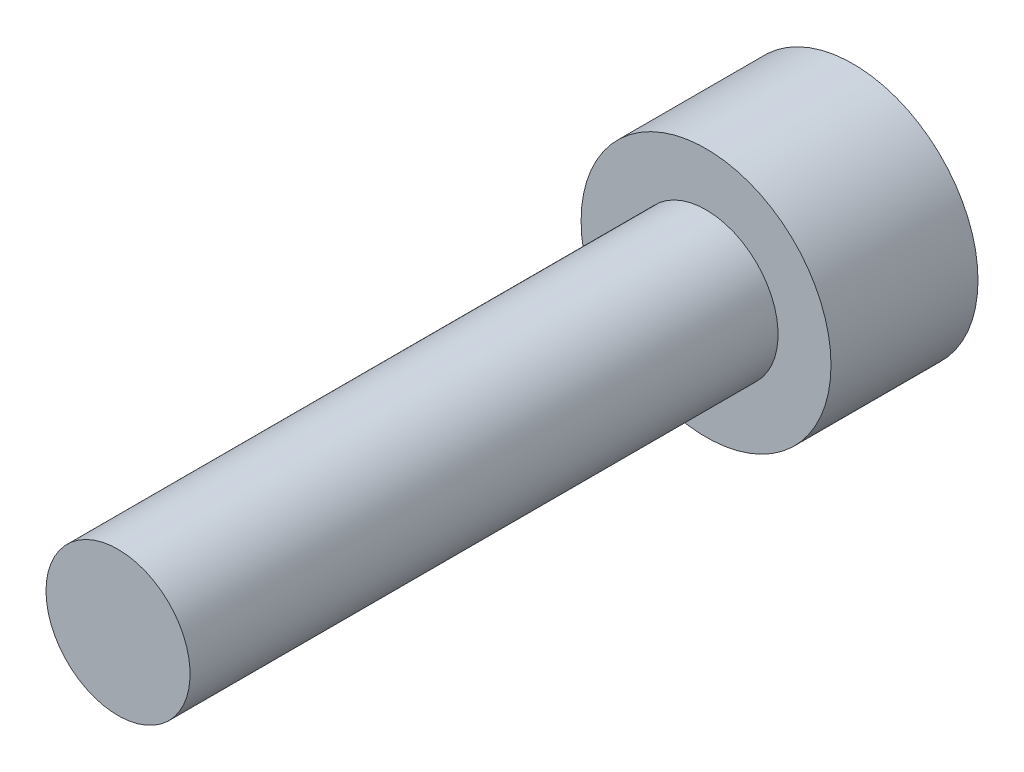
from build123d import *

# Parameters (mm, degrees)
CUT_EXTRUDE1_DEPTH = 2.5


with BuildPart() as part:
    # Sketch1 → Revolve1 (revolve)
    with BuildSketch(Plane(origin=(0, 0, 0), x_dir=(1, 0, 0), z_dir=(0, 1, 0))):
        Polygon((0, 5), (-4.25, 5), (-4.25, 0), (-2.45, 0), (-2.45, -20), (0, -20), align=None)
    revolve(axis=Axis((0, 0, -5), (0, 0, 1)))

    # Sketch2 → Cut-Extrude1 (cut)
    with BuildSketch(Plane(origin=(0, 0, -5), x_dir=(-1, 0, 0), z_dir=(0, 0, -1))):
        Polygon((-1.333679122, 2.31), (-2.667358244, 0), (-1.333679122, -2.31), (1.333679122, -2.31), (2.667358244, 0), (1.333679122, 2.31), align=None)
    extrude(amount=-CUT_EXTRUDE1_DEPTH, mode=Mode.SUBTRACT)

    # Sketch3 → Cut-Revolve1 (revolve, cut)
    with BuildSketch(Plane(origin=(0, 0, 0), x_dir=(1, 0, 0), z_dir=(0, 1, 0))):
        Polygon((-2.667358244, 5), (-0.667358244, 3), (-0.667358244, 5), align=None)
    revolve(axis=Axis((0, 0, 0), (0, 0, -1)), mode=Mode.SUBTRACT)


solid = part.part
